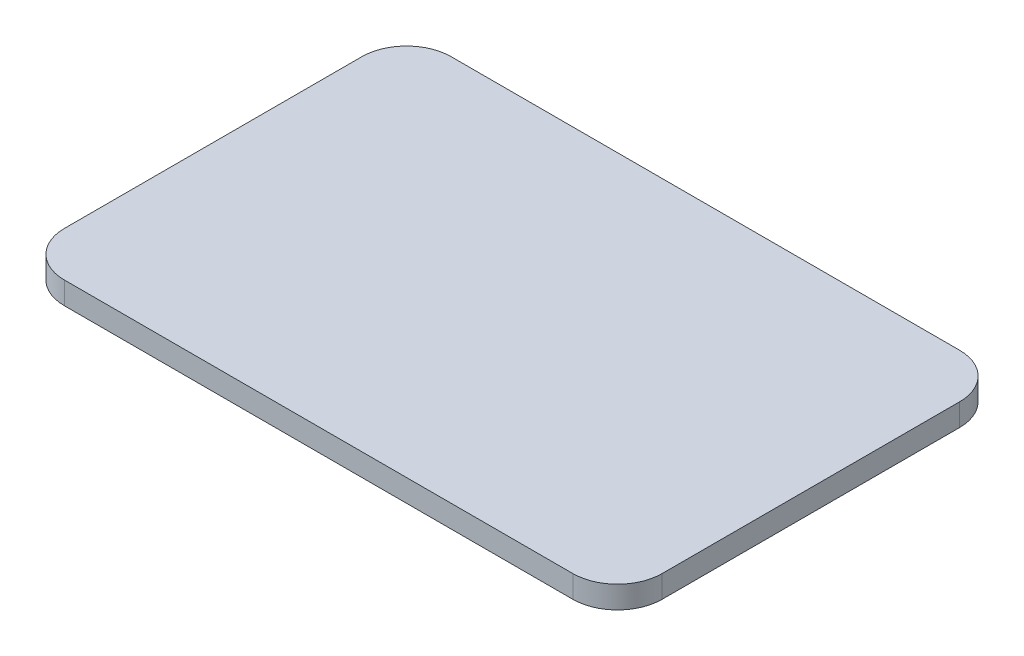
from build123d import *

# Parameters (mm, degrees)
SKETCH1_W           = 34
SKETCH1_H           = 22
BOSS_EXTRUDE1_DEPTH = 1.27
FILLET1_R           = 2.54


with BuildPart() as part:
    # Sketch1 → Boss-Extrude1 (new body)
    with BuildSketch(Plane(origin=(0, 0, 0), x_dir=(1, 0, 0), z_dir=(0, 1, 0))):
        with Locations((17, 11)):
            Rectangle(SKETCH1_W, SKETCH1_H)
    extrude(amount=BOSS_EXTRUDE1_DEPTH)

    # Fillet1
    fillet1_edges = [part.edges().sort_by_distance(p)[0] for p in [
        (0, 0.635, 0),
        (0, 0.635, -22),
        (34, 0.635, -22),
        (34, 0.635, 0),
    ]]
    fillet(fillet1_edges, radius=FILLET1_R)


solid = part.part
